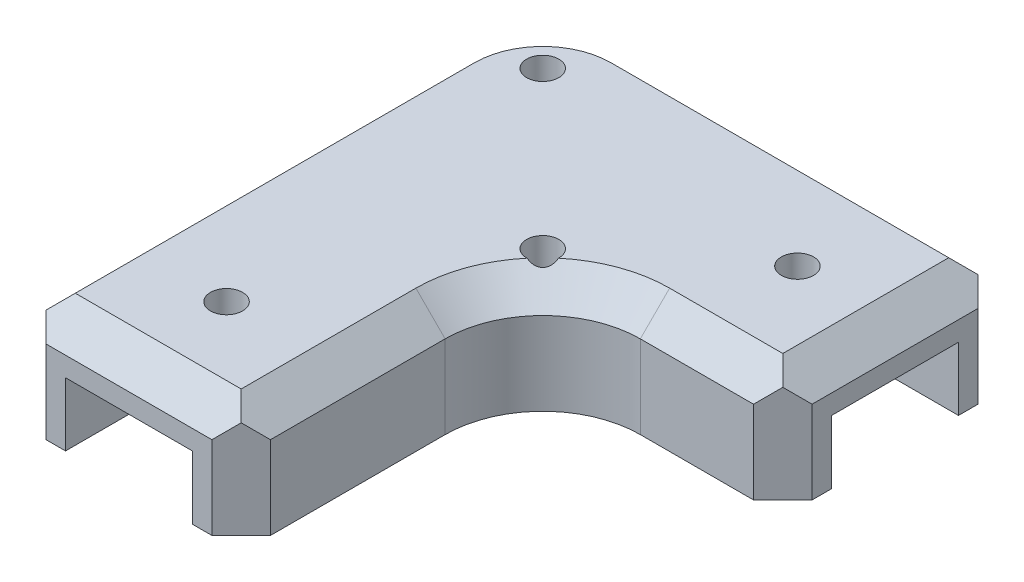
from build123d import *

# Parameters (mm, degrees)
SKETCH_1_W          = 23
SKETCH_1_H          = 23
SKETCH_1_W_2        = 13
SKETCH_1_H_2        = 13
EXTRUDE_1_DEPTH     = 53.9
SKETCH_2_R          = 1.65
CUT_EXTRUDE_1_DEPTH = 34
SKETCH_4_W          = 23
SKETCH_4_H          = 23
SKETCH_4_R          = 3
EXTRUDE_2_DEPTH     = 14.6
SKETCH_5_W          = 23
SKETCH_5_H          = 23
SKETCH_5_W_2        = 13
SKETCH_5_H_2        = 13
EXTRUDE_1_2_DEPTH   = 10
SKETCH_6_R          = 1.65
CUT_EXTRUDE_2_DEPTH = 39
SKETCH_7_W          = 13
SKETCH_7_H          = 13
CUT_EXTRUDE_3_DEPTH = 24.6
CHAMFER_1_SIZE      = 3
SKETCH_8_W          = 47.6
SKETCH_8_H          = 53.9
CUT_EXTRUDE_4_DEPTH = 11.5
EXTRUDE_3_DEPTH     = 6.5
FILLET_1_R          = 10
FILLET_2_R          = 10
SKETCH_10_R         = 1.65
CUT_EXTRUDE_5_DEPTH = 28.5
CHAMFER_3_SIZE      = 3
CHAMFER_4_SIZE      = 3
CHAMFER_5_SIZE      = 3


with BuildPart() as part:
    # 草图1 → Extrude 1 (new body)
    with BuildSketch(Plane.XY):
        with Locations((6.5, 6.5)):
            Rectangle(SKETCH_1_W, SKETCH_1_H)
        with Locations((6.5, 6.5)):
            Rectangle(SKETCH_1_W_2, SKETCH_1_H_2, mode=Mode.SUBTRACT)
    extrude(amount=EXTRUDE_1_DEPTH)

    # 草图2 → 切除-拉伸1 (cut)
    with BuildSketch(Plane.XZ.offset(5)):
        with Locations(Location((6.5, 43.9, 0), (0, 0, 270))):
            Circle(SKETCH_2_R)
    extrude(amount=-CUT_EXTRUDE_1_DEPTH, mode=Mode.SUBTRACT)

    # 草图4 → 凸台-拉伸2 (add)
    with BuildSketch(Plane(origin=(18, 0, 0), x_dir=(0, 0, -1), z_dir=(1, 0, 0))):
        with Locations((-11.5, 6.5)):
            Rectangle(SKETCH_4_W, SKETCH_4_H)
        with Locations(Location((-11.5, 6.5, 0), (0, 0, 90))):
            Circle(SKETCH_4_R, mode=Mode.SUBTRACT)
    extrude(amount=EXTRUDE_2_DEPTH)

    # 草图5 → Extrude 1 2 (add)
    with BuildSketch(Plane(origin=(32.6, 0, 0), x_dir=(0, 0, -1), z_dir=(1, 0, 0))):
        with Locations((-11.5, 6.5)):
            Rectangle(SKETCH_5_W, SKETCH_5_H)
        with Locations((-11.5, 6.5)):
            Rectangle(SKETCH_5_W_2, SKETCH_5_H_2, mode=Mode.SUBTRACT)
    extrude(amount=EXTRUDE_1_2_DEPTH)

    # 草图6 → 切除-拉伸2 (cut)
    with BuildSketch(Plane(origin=(0, 18, 0), x_dir=(1, 0, 0), z_dir=(0, 1, 0))):
        with Locations(Location((32.6, -11.5, 0), (0, 0, 270))):
            Circle(SKETCH_6_R)
    extrude(amount=-CUT_EXTRUDE_2_DEPTH, mode=Mode.SUBTRACT)

    # 草图7 → 切除-拉伸3 (cut)
    with BuildSketch(Plane(origin=(32.6, 0, 0), x_dir=(0, 0, -1), z_dir=(1, 0, 0))):
        with Locations((-11.5, 6.5)):
            Rectangle(SKETCH_7_W, SKETCH_7_H)
    extrude(amount=-CUT_EXTRUDE_3_DEPTH, mode=Mode.SUBTRACT)

    # 倒角1
    chamfer_1_edges = [part.edges().sort_by_distance(p)[0] for p in [
        (13, 6.5, 18),
    ]]
    chamfer(chamfer_1_edges, length=CHAMFER_1_SIZE)

    # 草图8 → 切除-拉伸4 (cut)
    with BuildSketch(Plane.XZ.offset(5)):
        with Locations((18.8, 26.95)):
            Rectangle(SKETCH_8_W, SKETCH_8_H)
    extrude(amount=-CUT_EXTRUDE_4_DEPTH, mode=Mode.SUBTRACT)

    # 草图9 → 凸台-拉伸3 (add)
    with BuildSketch(Plane.XZ.offset(-13)):
        Polygon((13, 5), (0, 18), (0, 0), (13, 0), align=None)
    extrude(amount=EXTRUDE_3_DEPTH)

    # 圆角1
    fillet_1_edges = [part.edges().sort_by_distance(p)[0] for p in [
        (-5, 12.25, 0),
    ]]
    fillet(fillet_1_edges, radius=FILLET_1_R)

    # 圆角2
    fillet_2_edges = [part.edges().sort_by_distance(p)[0] for p in [
        (18, 12.25, 23),
    ]]
    fillet(fillet_2_edges, radius=FILLET_2_R)

    # 草图10 → 切除-拉伸5 (cut)
    with BuildSketch(Plane.XZ.offset(-6.5)):
        with Locations(Location((2, 7, 0), (0, 0, 270))):
            Circle(SKETCH_10_R)
        with Locations(Location((18, 23, 0), (0, 0, 270))):
            Circle(SKETCH_10_R)
    extrude(amount=-CUT_EXTRUDE_5_DEPTH, mode=Mode.SUBTRACT)

    # 倒角3
    # the kernel refuses this chamfer: 3 mm, written as the material it takes off along each edge
    with BuildSketch(Plane(origin=(5, 18, 10), x_dir=(0, 0, -1), z_dir=(1, 0, 0))) as chamfer_3_piece_1:
        Polygon((10 - CHAMFER_3_SIZE, 0), (10, -CHAMFER_3_SIZE), (10, 0), align=None)
    revolve(axis=Axis((5, 18, 10), (0, 1, 0)), revolution_arc=90, mode=Mode.SUBTRACT)
    with BuildSketch(Plane(origin=(28, 18, 33), x_dir=(-1, 0, 0), z_dir=(0, 0, 1))) as chamfer_3_piece_2:
        Polygon((10 + CHAMFER_3_SIZE, 0), (10, CHAMFER_3_SIZE), (10, 0), align=None)
    revolve(axis=Axis((28, 18, 33), (0, -1, 0)), revolution_arc=90, mode=Mode.SUBTRACT)
    with BuildSketch(Plane(origin=(28, 18, 23), x_dir=(0, 0.027495876610586768, -0.9996219169112968), z_dir=(1, 0, 0))) as chamfer_3_piece_3:
        Polygon((CHAMFER_3_SIZE * 0.999621916911, -CHAMFER_3_SIZE * 0.0274958766106), (-CHAMFER_3_SIZE * 0.0274958766106, -CHAMFER_3_SIZE * 0.999621916911), (0, 0), align=None)
    extrude(amount=22.315048964, mode=Mode.SUBTRACT)
    with BuildSketch(Plane(origin=(50.315048964, 18, 0), x_dir=(0, 0.027495876610586778, 0.9996219169112968), z_dir=(-1, 0, 0))) as chamfer_3_piece_4:
        Polygon((CHAMFER_3_SIZE * 0.999621916911, -CHAMFER_3_SIZE * 0.0274958766106), (-CHAMFER_3_SIZE * 0.0274958766106, -CHAMFER_3_SIZE * 0.999621916911), (0, 0), align=None)
    extrude(amount=45.315048964, mode=Mode.SUBTRACT)
    with BuildSketch(Plane(origin=(-5, 18, 10), x_dir=(0.9996219169112968, 0.027495876610586778, 0), z_dir=(0, 0, 1))) as chamfer_3_piece_5:
        Polygon((CHAMFER_3_SIZE * 0.999621916911, -CHAMFER_3_SIZE * 0.0274958766106), (-CHAMFER_3_SIZE * 0.0274958766106, -CHAMFER_3_SIZE * 0.999621916911), (0, 0), align=None)
    extrude(amount=51.615048964, mode=Mode.SUBTRACT)
    with BuildSketch(Plane(origin=(18, 18, 33), x_dir=(-0.9996219169112968, 0.02749587661058678, 0), z_dir=(0, 0, 1))) as chamfer_3_piece_6:
        Polygon((CHAMFER_3_SIZE * 0.999621916911, CHAMFER_3_SIZE * 0.0274958766106), (-CHAMFER_3_SIZE * 0.0274958766106, CHAMFER_3_SIZE * 0.999621916911), (0, 0), align=None)
    extrude(amount=28.615048964, mode=Mode.SUBTRACT)

    # 倒角4
    chamfer_4_edges = [part.edges().sort_by_distance(p)[0] for p in [
        (42.6, 18, 11.5),
        (6.5, 18, 53.9),
    ]]
    chamfer(chamfer_4_edges, length=CHAMFER_4_SIZE)

    # 倒角5
    chamfer_5_edges = [part.edges().sort_by_distance(p)[0] for p in [
        (42.6, 10.75, 0),
        (18, 10.75, 53.9),
        (-5, 10.75, 53.9),
        (42.6, 10.75, 23),
    ]]
    chamfer(chamfer_5_edges, length=CHAMFER_5_SIZE)


solid = part.part
